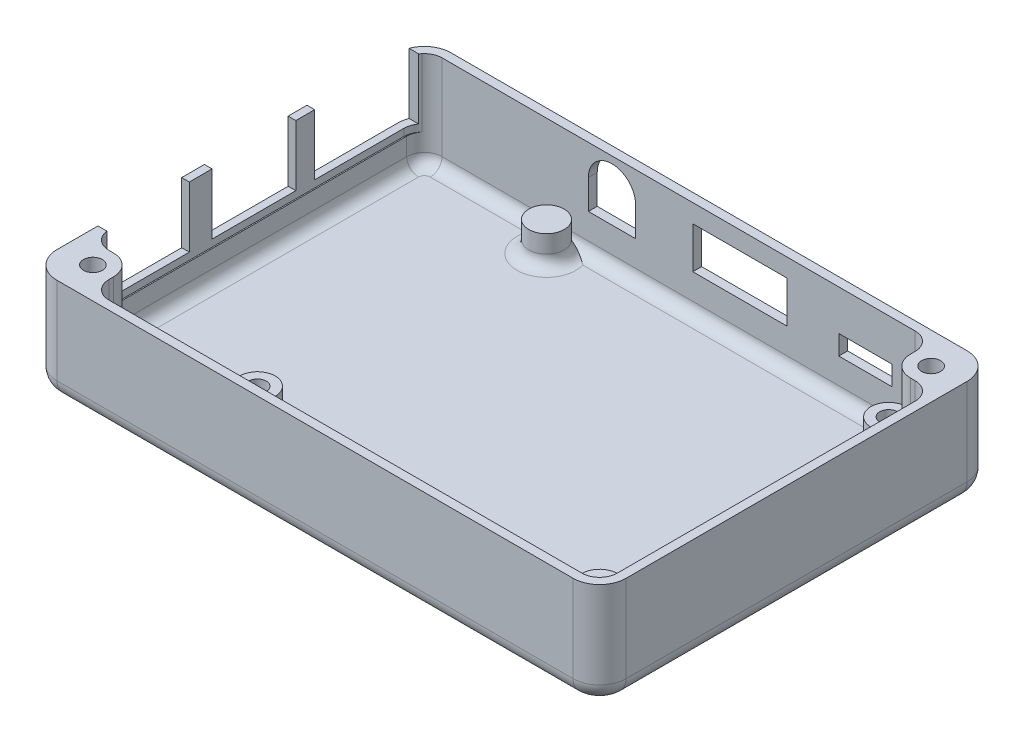
from build123d import *

# Parameters (mm, degrees)
BOSS_EXTRUDE1_DEPTH = 1.25
BOSS_EXTRUDE2_DEPTH = 17.75
CUT_EXTRUDE1_DEPTH  = 11.5
SKETCH3_R           = 3
SKETCH3_R_2         = 1.5
BOSS_EXTRUDE3_DEPTH = 5
CUT_EXTRUDE2_REACH  = 93.136
SKETCH4_W           = 9
SKETCH4_H           = 3.31
SKETCH4_W_2         = 16
SKETCH4_H_2         = 7.05
CUT_EXTRUDE3_REACH  = 106.287
SKETCH5_W           = 17
SKETCH5_H           = 10.3
SKETCH5_W_2         = 14.2
BOSS_EXTRUDE4_DEPTH = 16.5
SKETCH6_R           = 2.5
SKETCH6_R_2         = 1.6
CUT_EXTRUDE4_DEPTH  = 3
SKETCH6_2_R         = 1.6
CUT_EXTRUDE5_DEPTH  = 72.357895319
FILLET4_R           = 3
FILLET1_R           = 3
FILLET2_R           = 2


with BuildPart() as part:
    # Sketch1 → Boss-Extrude1 (new body)
    with BuildSketch(Plane(origin=(0, 0, 0), x_dir=(1, 0, 0), z_dir=(0, 1, 0))):
        with BuildLine():
            Line((-54.901224723, -33.832438717), (32.598775277, -33.832438717))
            ThreePointArc((32.598775277, -33.832438717), (34.720095621, -32.953759061), (35.598775277, -30.832438717))
            Line((35.598775277, -30.832438717), (35.598775277, 26.967561283))
            ThreePointArc((35.598775277, 26.967561283), (34.720095621, 29.088881626), (32.598775277, 29.967561283))
            Line((32.598775277, 29.967561283), (-54.901224723, 29.967561283))
            ThreePointArc((-54.901224723, 29.967561283), (-57.022545066, 29.088881626), (-57.901224723, 26.967561283))
            Line((-57.901224723, 26.967561283), (-57.901224723, -30.832438717))
            ThreePointArc((-57.901224723, -30.832438717), (-57.022545066, -32.953759061), (-54.901224723, -33.832438717))
        make_face()
    extrude(amount=BOSS_EXTRUDE1_DEPTH)

    # Sketch1<3> → Boss-Extrude2 (add)
    with BuildSketch(Plane(origin=(0, 0, 0), x_dir=(1, 0, 0), z_dir=(0, 1, 0))):
        with BuildLine():
            Line((-54.901224723, 31.467561283), (32.598775277, 31.467561283))
            ThreePointArc((32.598775277, 31.467561283), (35.780755792, 30.149541798), (37.098775277, 26.967561283))
            Line((37.098775277, 26.967561283), (37.098775277, -30.832438717))
            ThreePointArc((37.098775277, -30.832438717), (35.780755792, -34.014419233), (32.598775277, -35.332438717))
            Line((32.598775277, -35.332438717), (-54.901224723, -35.332438717))
            ThreePointArc((-54.901224723, -35.332438717), (-58.083205238, -34.014419233), (-59.401224723, -30.832438717))
            Line((-59.401224723, -30.832438717), (-59.401224723, 26.967561283))
            ThreePointArc((-59.401224723, 26.967561283), (-58.083205238, 30.149541798), (-54.901224723, 31.467561283))
        make_face()
        with BuildLine():
            Line((-54.901224723, -33.832438717), (32.598775277, -33.832438717))
            ThreePointArc((32.598775277, -33.832438717), (34.720095621, -32.953759061), (35.598775277, -30.832438717))
            Line((35.598775277, -30.832438717), (35.598775277, 26.967561283))
            ThreePointArc((35.598775277, 26.967561283), (34.720095621, 29.088881626), (32.598775277, 29.967561283))
            Line((32.598775277, 29.967561283), (-54.901224723, 29.967561283))
            ThreePointArc((-54.901224723, 29.967561283), (-57.022545066, 29.088881626), (-57.901224723, 26.967561283))
            Line((-57.901224723, 26.967561283), (-57.901224723, -30.832438717))
            ThreePointArc((-57.901224723, -30.832438717), (-57.022545066, -32.953759061), (-54.901224723, -33.832438717))
        make_face(mode=Mode.SUBTRACT)
    extrude(amount=BOSS_EXTRUDE2_DEPTH)

    # Sketch2 → Cut-Extrude1 (cut)
    with BuildSketch(Plane(origin=(0, 17.75, 0), x_dir=(1, 0, 0), z_dir=(0, 1, 0))):
        with BuildLine():
            Line((27.798775277, -25.632438717), (27.798775277, 26.667561283))
            ThreePointArc((27.798775277, 26.667561283), (26.861516977, 28.930302983), (24.598775277, 29.867561283))
            Line((24.598775277, 29.867561283), (-54.901224723, 29.867561283))
            ThreePointArc((-54.901224723, 29.867561283), (-57.163966423, 28.930302983), (-58.101224723, 26.667561283))
            Line((-58.101224723, 26.667561283), (-58.101224723, -22.432438717))
            ThreePointArc((-58.101224723, -22.432438717), (-57.163966423, -24.695180417), (-54.901224723, -25.632438717))
            Line((-54.901224723, -25.632438717), (27.798775277, -25.632438717))
        make_face()
    extrude(amount=-CUT_EXTRUDE1_DEPTH, mode=Mode.SUBTRACT)

    # Sketch3 → Boss-Extrude3 (add)
    # profile 1 of 4: a face of its own
    with BuildSketch(Plane(origin=(0, 1.25, 0), x_dir=(1, 0, 0), z_dir=(0, 1, 0))):
        with Locations(Location((24.148775277, -22.382438717, 0), (0, 0, 90))):
            Circle(SKETCH3_R)
    # profile 2 of 4: a face of its own
    with BuildSketch(Plane(origin=(0, 1.25, 0), x_dir=(1, 0, 0), z_dir=(0, 1, 0))):
        with Locations(Location((-33.851224723, -22.382438717, 0), (0, 0, 90))):
            Circle(SKETCH3_R)
        with Locations(Location((-33.851224723, -22.382438717, 0), (0, 0, 90))):
            Circle(SKETCH3_R_2, mode=Mode.SUBTRACT)
    # profile 3 of 4: a face of its own
    with BuildSketch(Plane(origin=(0, 1.25, 0), x_dir=(1, 0, 0), z_dir=(0, 1, 0))):
        with Locations(Location((24.148775277, 26.617561283, 0), (0, 0, 90))):
            Circle(SKETCH3_R)
        with Locations(Location((24.148775277, 26.617561283, 0), (0, 0, 90))):
            Circle(SKETCH3_R_2, mode=Mode.SUBTRACT)
    # profile 4 of 4: a face of its own
    with BuildSketch(Plane(origin=(0, 1.25, 0), x_dir=(1, 0, 0), z_dir=(0, 1, 0))):
        with Locations(Location((-33.851224723, 26.617561283, 0), (0, 0, 90))):
            Circle(SKETCH3_R)
    extrude(amount=BOSS_EXTRUDE3_DEPTH)

    # Sketch4 → Cut-Extrude2 (cut, up to next)
    with BuildSketch(Plane(origin=(0, 0, -31.467561283), x_dir=(-1, 0, 0), z_dir=(0, 0, -1)), mode=Mode.PRIVATE) as cut_extrude2_sk1:
        with Locations((-16.848775277, 9.255)):
            Rectangle(SKETCH4_W, SKETCH4_H)
    cut_extrude2_tool1 = extrude(cut_extrude2_sk1.sketch, amount=-CUT_EXTRUDE2_REACH, mode=Mode.PRIVATE) & part.part
    # Sketch4 → Cut-Extrude2 (cut, up to next)
    with BuildSketch(Plane(origin=(0, 0, -31.467561283), x_dir=(-1, 0, 0), z_dir=(0, 0, -1)), mode=Mode.PRIVATE) as cut_extrude2_sk2:
        with Locations((4.401224723, 11.125)):
            Rectangle(SKETCH4_W_2, SKETCH4_H_2)
    cut_extrude2_tool2 = extrude(cut_extrude2_sk2.sketch, amount=-CUT_EXTRUDE2_REACH, mode=Mode.PRIVATE) & part.part
    # Sketch4 → Cut-Extrude2 (cut, up to next)
    with BuildSketch(Plane(origin=(0, 0, -31.467561283), x_dir=(-1, 0, 0), z_dir=(0, 0, -1)), mode=Mode.PRIVATE) as cut_extrude2_sk3:
        with BuildLine():
            Line((22.101224723, 7.6), (30.101224723, 7.6))
            Line((30.101224723, 7.6), (30.101224723, 12.6))
            ThreePointArc((30.101224723, 12.6), (26.101224723, 16.6), (22.101224723, 12.6))
            Line((22.101224723, 12.6), (22.101224723, 7.6))
        make_face()
    cut_extrude2_tool3 = extrude(cut_extrude2_sk3.sketch, amount=-CUT_EXTRUDE2_REACH, mode=Mode.PRIVATE) & part.part
    add(cut_extrude2_tool1.solids().sort_by_distance((16.848775, 9.255, -31.467561))[0], mode=Mode.SUBTRACT)
    add(cut_extrude2_tool2.solids().sort_by_distance((-4.401225, 11.125, -31.467561))[0], mode=Mode.SUBTRACT)
    add(cut_extrude2_tool3.solids().sort_by_distance((-26.101225, 11.719746, -31.467561))[0], mode=Mode.SUBTRACT)

    # Sketch5 → Cut-Extrude3 (cut, up to next)
    with BuildSketch(Plane.ZY.offset(59.401224723), mode=Mode.PRIVATE) as cut_extrude3_sk1:
        with Locations((-20.067561283, 12.6)):
            Rectangle(SKETCH5_W, SKETCH5_H)
    cut_extrude3_tool1 = extrude(cut_extrude3_sk1.sketch, amount=-CUT_EXTRUDE3_REACH, mode=Mode.PRIVATE) & part.part
    # Sketch5 → Cut-Extrude3 (cut, up to next)
    with BuildSketch(Plane.ZY.offset(59.401224723), mode=Mode.PRIVATE) as cut_extrude3_sk2:
        with Locations((-1.267561283, 12.6)):
            Rectangle(SKETCH5_W_2, SKETCH5_H)
    cut_extrude3_tool2 = extrude(cut_extrude3_sk2.sketch, amount=-CUT_EXTRUDE3_REACH, mode=Mode.PRIVATE) & part.part
    # Sketch5 → Cut-Extrude3 (cut, up to next)
    with BuildSketch(Plane.ZY.offset(59.401224723), mode=Mode.PRIVATE) as cut_extrude3_sk3:
        with Locations((16.782438717, 12.6)):
            Rectangle(SKETCH5_W_2, SKETCH5_H)
    cut_extrude3_tool3 = extrude(cut_extrude3_sk3.sketch, amount=-CUT_EXTRUDE3_REACH, mode=Mode.PRIVATE) & part.part
    add(cut_extrude3_tool1.solids().sort_by_distance((-59.401225, 12.6, -20.067561))[0], mode=Mode.SUBTRACT)
    add(cut_extrude3_tool2.solids().sort_by_distance((-59.401225, 12.6, -1.267561))[0], mode=Mode.SUBTRACT)
    add(cut_extrude3_tool3.solids().sort_by_distance((-59.401225, 12.6, 16.782439))[0], mode=Mode.SUBTRACT)

    # Sketch7 → Boss-Extrude4 (add)
    with BuildSketch(Plane(origin=(0, 1.25, 0), x_dir=(1, 0, 0), z_dir=(0, 1, 0))):
        with BuildLine():
            Line((31.799384744, 22.66817075), (35.598775277, 22.66817075))
            Line((35.598775277, 22.66817075), (35.598775277, 26.967561283))
            ThreePointArc((35.598775277, 26.967561283), (34.720095621, 29.088881626), (32.598775277, 29.967561283))
            Line((32.598775277, 29.967561283), (28.299384744, 29.967561283))
            Line((28.299384744, 29.967561283), (28.299384744, 26.16817075))
            ThreePointArc((28.299384744, 26.16817075), (29.32451101, 23.693297016), (31.799384744, 22.66817075))
        make_face()
        with BuildLine():
            Line((-50.60183419, -30.033048184), (-50.60183419, -33.832438717))
            Line((-50.60183419, -33.832438717), (-54.901224723, -33.832438717))
            ThreePointArc((-54.901224723, -33.832438717), (-57.022545066, -32.953759061), (-57.901224723, -30.832438717))
            Line((-57.901224723, -30.832438717), (-57.901224723, -26.533048184))
            Line((-57.901224723, -26.533048184), (-54.10183419, -26.533048184))
            ThreePointArc((-54.10183419, -26.533048184), (-51.626960456, -27.55817445), (-50.60183419, -30.033048184))
        make_face()
    extrude(amount=BOSS_EXTRUDE4_DEPTH)

    # Sketch6 → Cut-Extrude4 (cut)
    # profile 1 of 2: a face of its own
    with BuildSketch(Plane(origin=(0, 0, 0), x_dir=(1, 0, 0), z_dir=(0, 1, 0))):
        with Locations(Location((31.799384744, 26.16817075, 0), (0, 0, 270))):
            Circle(SKETCH6_R)
        with Locations(Location((31.799384744, 26.16817075, 0), (0, 0, 270))):
            Circle(SKETCH6_R_2, mode=Mode.SUBTRACT)
    # profile 2 of 2: a face of its own
    with BuildSketch(Plane(origin=(0, 0, 0), x_dir=(1, 0, 0), z_dir=(0, 1, 0))):
        with Locations(Location((-54.10183419, -30.033048184, 0), (0, 0, 270))):
            Circle(SKETCH6_R)
        with Locations(Location((-54.10183419, -30.033048184, 0), (0, 0, 270))):
            Circle(SKETCH6_R_2, mode=Mode.SUBTRACT)
    extrude(amount=CUT_EXTRUDE4_DEPTH, mode=Mode.SUBTRACT)

    # Sketch6<2> → Cut-Extrude5 (cut, through all)
    with BuildSketch(Plane(origin=(0, 0, 0), x_dir=(1, 0, 0), z_dir=(0, 1, 0))):
        with Locations(Location((31.799384744, 26.16817075, 0), (0, 0, 90))):
            Circle(SKETCH6_2_R)
        with Locations(Location((-54.10183419, -30.033048184, 0), (0, 0, 90))):
            Circle(SKETCH6_2_R)
    extrude(amount=CUT_EXTRUDE5_DEPTH, mode=Mode.SUBTRACT)

    # Fillet4
    fillet4_edges = [part.edges().sort_by_distance(p)[0] for p in [
        (-50.60183419, 9.5, 33.832438717),
        (35.598775277, 9.5, -22.66817075),
        (-57.901224723, 9.5, 26.533048184),
        (28.299384744, 9.5, -29.967561283),
    ]]
    fillet(fillet4_edges, radius=FILLET4_R)

    # Fillet1
    # the kernel refuses this fillet: 3 mm, written as the material it takes off along each edge
    with BuildSketch(Plane(origin=(-54.901224723, 0, -26.967561283), x_dir=(-1, 0, 0), z_dir=(0, 0, 1))) as fillet1_piece_1:
        with BuildLine():
            CenterArc((4.5 - FILLET1_R, -FILLET1_R), FILLET1_R, 0, 90)
            Line((4.5 - FILLET1_R, 0), (4.5, 0))
            Line((4.5, 0), (4.5, -FILLET1_R))
        make_face()
    revolve(axis=Axis((-54.901224723, 0, -26.967561283), (0, -1, 0)), revolution_arc=90, mode=Mode.SUBTRACT)
    with BuildSketch(Plane(origin=(-59.401224723, 0, 30.832438717), x_dir=(0, 1, 0), z_dir=(0, 0, -1)), Plane(origin=(37.098775277, 0, -26.967561283), x_dir=(0, 1, 0), z_dir=(0, 0, 1))) as fillet1_piece_2:
        with BuildLine():
            CenterArc((FILLET1_R, FILLET1_R), FILLET1_R, 180, 90)
            Line((0, FILLET1_R), (0, 0))
            Line((0, 0), (FILLET1_R, 0))
        make_face()
    extrude(amount=57.8, mode=Mode.SUBTRACT)
    with BuildSketch(Plane(origin=(-54.901224723, 0, 30.832438717), x_dir=(0, 0, 1), z_dir=(1, 0, 0))) as fillet1_piece_3:
        with BuildLine():
            CenterArc((4.5 - FILLET1_R, -FILLET1_R), FILLET1_R, 0, 90)
            Line((4.5 - FILLET1_R, 0), (4.5, 0))
            Line((4.5, 0), (4.5, -FILLET1_R))
        make_face()
    revolve(axis=Axis((-54.901224723, 0, 30.832438717), (0, -1, 0)), revolution_arc=90, mode=Mode.SUBTRACT)
    with BuildSketch(Plane(origin=(32.598775277, 0, 35.332438717), x_dir=(0, 1, 0), z_dir=(-1, 0, 0)), Plane(origin=(-54.901224723, 0, -31.467561283), x_dir=(0, 1, 0), z_dir=(1, 0, 0))) as fillet1_piece_4:
        with BuildLine():
            CenterArc((FILLET1_R, FILLET1_R), FILLET1_R, 180, 90)
            Line((0, FILLET1_R), (0, 0))
            Line((0, 0), (FILLET1_R, 0))
        make_face()
    extrude(amount=87.5, mode=Mode.SUBTRACT)
    with BuildSketch(Plane(origin=(32.598775277, 0, 30.832438717), x_dir=(1, 0, 0), z_dir=(0, 0, -1))) as fillet1_piece_5:
        with BuildLine():
            CenterArc((4.5 - FILLET1_R, -FILLET1_R), FILLET1_R, 0, 90)
            Line((4.5 - FILLET1_R, 0), (4.5, 0))
            Line((4.5, 0), (4.5, -FILLET1_R))
        make_face()
    revolve(axis=Axis((32.598775277, 0, 30.832438717), (0, -1, 0)), revolution_arc=90, mode=Mode.SUBTRACT)
    with BuildSketch(Plane(origin=(32.598775277, 0, -26.967561283), x_dir=(0, 0, -1), z_dir=(-1, 0, 0))) as fillet1_piece_6:
        with BuildLine():
            CenterArc((4.5 - FILLET1_R, -FILLET1_R), FILLET1_R, 0, 90)
            Line((4.5 - FILLET1_R, 0), (4.5, 0))
            Line((4.5, 0), (4.5, -FILLET1_R))
        make_face()
    revolve(axis=Axis((32.598775277, 0, -26.967561283), (0, -1, 0)), revolution_arc=90, mode=Mode.SUBTRACT)

    # Fillet2
    # the kernel refuses this fillet: 2 mm, written as the material it adds along each edge
    with BuildSketch(Plane(origin=(-54.901224723, 1.25, -26.967561283), x_dir=(0, 0, -1), z_dir=(1, 0, 0))) as fillet2_piece_1:
        with BuildLine():
            CenterArc((3 - FILLET2_R, FILLET2_R), FILLET2_R, 270, 90)
            Line((3 - FILLET2_R, 0), (3, 0))
            Line((3, 0), (3, FILLET2_R))
        make_face()
    revolve(axis=Axis((-54.901224723, 1.25, -26.967561283), (0, 1, 0)), revolution_arc=90)
    with BuildSketch(Plane(origin=(24.148775277, 1.25, -26.617561283), x_dir=(0, 0, -1), z_dir=(1, 0, 0))) as fillet2_piece_2_section:
        with BuildLine():
            CenterArc((3 + FILLET2_R, FILLET2_R), FILLET2_R, 180, 90)
            Line((3, FILLET2_R), (3, 0))
            Line((3, 0), (3 + FILLET2_R, 0))
        make_face()
    fillet2_piece_2 = revolve(axis=Axis((24.148775277, 1.25, -26.617561283), (0, 1, 0)), mode=Mode.PRIVATE)
    fillet2_piece_2 = split(fillet2_piece_2, bisect_by=Plane(origin=(24.148775277, 1.25, -29.967561283), z_dir=(0, 0, 1)), keep=Keep.TOP, mode=Mode.PRIVATE)
    add(fillet2_piece_2)
    with BuildSketch(Plane(origin=(-33.851224723, 1.25, -26.617561283), x_dir=(0, 0, -1), z_dir=(1, 0, 0))) as fillet2_piece_3_section:
        with BuildLine():
            CenterArc((3 + FILLET2_R, FILLET2_R), FILLET2_R, 180, 90)
            Line((3, FILLET2_R), (3, 0))
            Line((3, 0), (3 + FILLET2_R, 0))
        make_face()
    fillet2_piece_3 = revolve(axis=Axis((-33.851224723, 1.25, -26.617561283), (0, 1, 0)), mode=Mode.PRIVATE)
    fillet2_piece_3 = split(fillet2_piece_3, bisect_by=Plane(origin=(-33.851224723, 1.25, -29.967561283), z_dir=(0, 0, 1)), keep=Keep.TOP, mode=Mode.PRIVATE)
    add(fillet2_piece_3)
    with BuildSketch(Plane(origin=(25.299384744, 1.25, -29.967561283), x_dir=(0, 1, 0), z_dir=(-1, 0, 0))) as fillet2_piece_4_section:
        with BuildLine():
            CenterArc((FILLET2_R, -FILLET2_R), FILLET2_R, 90, 90)
            Line((0, -FILLET2_R), (0, 0))
            Line((0, 0), (FILLET2_R, 0))
        make_face()
    fillet2_piece_4 = extrude(amount=80.200609467, mode=Mode.PRIVATE)
    fillet2_piece_4 = fillet2_piece_4 - Plane(origin=(24.148775277, 1.25, -26.617561283), x_dir=(0, 0, -1), z_dir=(0, -1, 0)) * Cylinder(1.5, 169, mode=Mode.PRIVATE)
    add(fillet2_piece_4)
    with BuildSketch(Plane(origin=(35.598775277, 1.25, 30.832438717), x_dir=(0, 1, 0), z_dir=(0, 0, -1))) as fillet2_piece_5:
        with BuildLine():
            CenterArc((FILLET2_R, -FILLET2_R), FILLET2_R, 90, 90)
            Line((0, -FILLET2_R), (0, 0))
            Line((0, 0), (FILLET2_R, 0))
        make_face()
    extrude(amount=50.500609467)
    with BuildSketch(Plane(origin=(31.799384744, 1.25, -22.66817075), x_dir=(0, 1, 0), z_dir=(1, 0, 0)), Plane(origin=(28.299384744, 1.25, -26.967561283), x_dir=(0, 1, 0), z_dir=(0, 0, 1))) as fillet2_piece_6:
        with BuildLine():
            CenterArc((FILLET2_R, FILLET2_R), FILLET2_R, 180, 90)
            Line((0, FILLET2_R), (0, 0))
            Line((0, 0), (FILLET2_R, 0))
        make_face()
    extrude(amount=0.799390533)
    with BuildSketch(Plane(origin=(31.799384744, 1.25, -26.16817075), x_dir=(-1, 0, 0), z_dir=(0, 0, -1))) as fillet2_piece_7:
        with BuildLine():
            CenterArc((3.5 + FILLET2_R, FILLET2_R), FILLET2_R, 180, 90)
            Line((3.5 + FILLET2_R, 0), (3.5, 0))
            Line((3.5, 0), (3.5, FILLET2_R))
        make_face()
    revolve(axis=Axis((31.799384744, 1.25, -26.16817075), (0, 1, 0)), revolution_arc=90)
    with BuildSketch(Plane(origin=(32.598775277, 1.25, 30.832438717), x_dir=(0, 0, 1), z_dir=(-1, 0, 0))) as fillet2_piece_8:
        with BuildLine():
            CenterArc((3 - FILLET2_R, FILLET2_R), FILLET2_R, 270, 90)
            Line((3 - FILLET2_R, 0), (3, 0))
            Line((3, 0), (3, FILLET2_R))
        make_face()
    revolve(axis=Axis((32.598775277, 1.25, 30.832438717), (0, 1, 0)), revolution_arc=90)
    with BuildSketch(Plane(origin=(-54.901224723, 1.25, 26.533048184), x_dir=(0, 1, 0), z_dir=(1, 0, 0)), Plane(origin=(-50.60183419, 1.25, 30.033048184), x_dir=(0, 1, 0), z_dir=(0, 0, 1))) as fillet2_piece_9:
        with BuildLine():
            CenterArc((FILLET2_R, -FILLET2_R), FILLET2_R, 90, 90)
            Line((0, -FILLET2_R), (0, 0))
            Line((0, 0), (FILLET2_R, 0))
        make_face()
    extrude(amount=0.799390533)
    with BuildSketch(Plane(origin=(-54.10183419, 1.25, 30.033048184), x_dir=(0, 0, -1), z_dir=(-1, 0, 0))) as fillet2_piece_10:
        with BuildLine():
            CenterArc((3.5 + FILLET2_R, -FILLET2_R), FILLET2_R, 90, 90)
            Line((3.5 + FILLET2_R, 0), (3.5, 0))
            Line((3.5, 0), (3.5, -FILLET2_R))
        make_face()
    revolve(axis=Axis((-54.10183419, 1.25, 30.033048184), (0, -1, 0)), revolution_arc=90)
    with BuildSketch(Plane(origin=(-57.901224723, 1.25, -26.967561283), x_dir=(1, 0, 0), z_dir=(0, 0, 1))) as fillet2_piece_11:
        with BuildLine():
            CenterArc((FILLET2_R, FILLET2_R), FILLET2_R, 180, 90)
            Line((0, FILLET2_R), (0, 0))
            Line((0, 0), (FILLET2_R, 0))
        make_face()
    extrude(amount=50.500609467)
    with BuildSketch(Plane(origin=(-47.60183419, 1.25, 33.832438717), x_dir=(0, 1, 0), z_dir=(1, 0, 0))) as fillet2_piece_12:
        with BuildLine():
            CenterArc((FILLET2_R, -FILLET2_R), FILLET2_R, 90, 90)
            Line((0, -FILLET2_R), (0, 0))
            Line((0, 0), (FILLET2_R, 0))
        make_face()
    extrude(amount=80.200609467)
    with BuildSketch(Plane(origin=(32.598775277, 1.25, -19.66817075), x_dir=(1, 0, 0), z_dir=(0, 0, 1))) as fillet2_piece_13:
        with BuildLine():
            CenterArc((3 - FILLET2_R, FILLET2_R), FILLET2_R, 270, 90)
            Line((3 - FILLET2_R, 0), (3, 0))
            Line((3, 0), (3, FILLET2_R))
        make_face()
    revolve(axis=Axis((32.598775277, 1.25, -19.66817075), (0, 1, 0)), revolution_arc=90)
    with BuildSketch(Plane(origin=(-47.60183419, 1.25, 30.832438717), x_dir=(-1, 0, 0), z_dir=(0, 0, -1))) as fillet2_piece_14:
        with BuildLine():
            CenterArc((3 - FILLET2_R, FILLET2_R), FILLET2_R, 270, 90)
            Line((3 - FILLET2_R, 0), (3, 0))
            Line((3, 0), (3, FILLET2_R))
        make_face()
    revolve(axis=Axis((-47.60183419, 1.25, 30.832438717), (0, 1, 0)), revolution_arc=90)
    with BuildSketch(Plane(origin=(25.299384744, 1.25, -26.967561283), x_dir=(1, 0, 0), z_dir=(0, 0, 1))) as fillet2_piece_15:
        with BuildLine():
            CenterArc((3 - FILLET2_R, FILLET2_R), FILLET2_R, 270, 90)
            Line((3 - FILLET2_R, 0), (3, 0))
            Line((3, 0), (3, FILLET2_R))
        make_face()
    revolve(axis=Axis((25.299384744, 1.25, -26.967561283), (0, 1, 0)), revolution_arc=90)
    with BuildSketch(Plane(origin=(-54.901224723, 1.25, 23.533048184), x_dir=(0, 0, 1), z_dir=(1, 0, 0))) as fillet2_piece_16:
        with BuildLine():
            CenterArc((3 - FILLET2_R, -FILLET2_R), FILLET2_R, 0, 90)
            Line((3 - FILLET2_R, 0), (3, 0))
            Line((3, 0), (3, -FILLET2_R))
        make_face()
    revolve(axis=Axis((-54.901224723, 1.25, 23.533048184), (0, -1, 0)), revolution_arc=90)
    with BuildSketch(Plane(origin=(24.148775277, 1.25, 22.382438717), x_dir=(0, 0, -1), z_dir=(1, 0, 0))) as fillet2_piece_17:
        with BuildLine():
            CenterArc((3 + FILLET2_R, FILLET2_R), FILLET2_R, 180, 90)
            Line((3, FILLET2_R), (3, 0))
            Line((3, 0), (3 + FILLET2_R, 0))
        make_face()
    revolve(axis=Axis((24.148775277, 1.25, 22.382438717), (0, 1, 0)))
    with BuildSketch(Plane(origin=(-33.851224723, 1.25, 22.382438717), x_dir=(0, 0, -1), z_dir=(1, 0, 0))) as fillet2_piece_18:
        with BuildLine():
            CenterArc((3 + FILLET2_R, FILLET2_R), FILLET2_R, 180, 90)
            Line((3, FILLET2_R), (3, 0))
            Line((3, 0), (3 + FILLET2_R, 0))
        make_face()
    revolve(axis=Axis((-33.851224723, 1.25, 22.382438717), (0, 1, 0)))


solid = part.part
